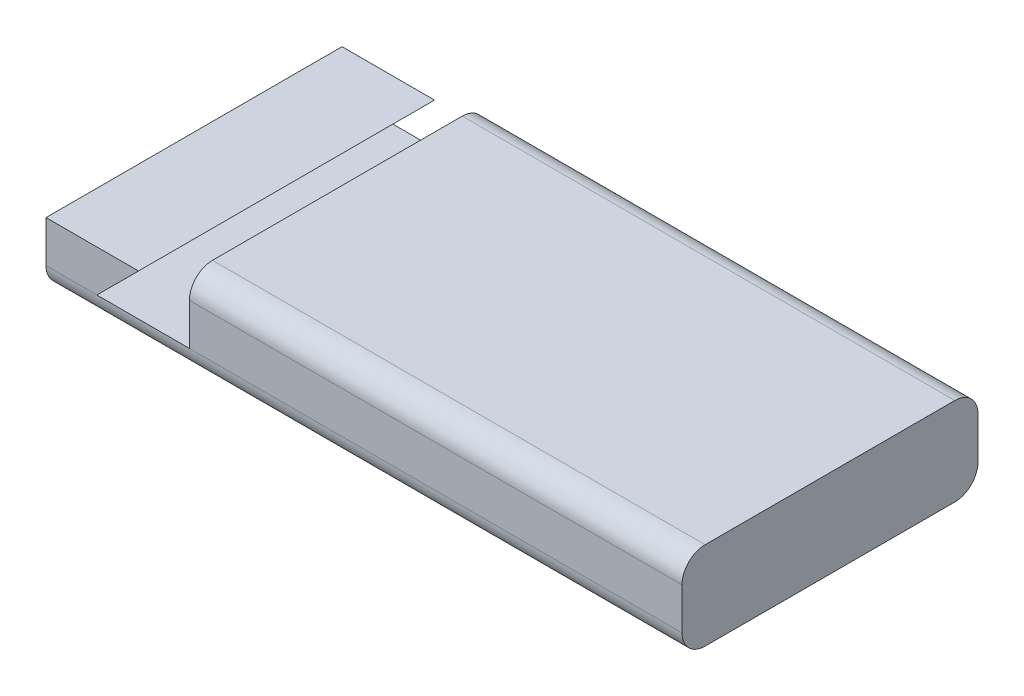
from build123d import *

# Parameters (mm, degrees)
SKETCH1_W           = 55
SKETCH1_H           = 25.6
BOSS_EXTRUDE1_DEPTH = 7.6
CUT_EXTRUDE1_DEPTH  = 25.6
FILLET1_R           = 2


with BuildPart() as part:
    # Sketch1 → Boss-Extrude1 (new body)
    with BuildSketch(Plane(origin=(0, 0, 0), x_dir=(1, 0, 0), z_dir=(0, 1, 0))):
        with Locations((27.5, 12.8)):
            Rectangle(SKETCH1_W, SKETCH1_H)
    extrude(amount=BOSS_EXTRUDE1_DEPTH)

    # Sketch2 → Cut-Extrude1 (cut)
    with BuildSketch(Plane(origin=(0, 0, -25.6), x_dir=(-1, 0, 0), z_dir=(0, 0, -1))):
        Polygon((-8, 5.6), (-4.4, 2), (-12.4, 2), (-12.4, 7.6), (0, 7.6), (0, 5.6), align=None)
    extrude(amount=-CUT_EXTRUDE1_DEPTH, mode=Mode.SUBTRACT)

    # Fillet1
    fillet1_edges = [part.edges().sort_by_distance(p)[0] for p in [
        (33.7, 7.6, -25.6),
        (33.7, 7.6, 0),
        (27.5, 0, -25.6),
        (27.5, 0, 0),
    ]]
    fillet(fillet1_edges, radius=FILLET1_R - 0.0001)  # a hair under: the kernel refuses the full size


solid = part.part
